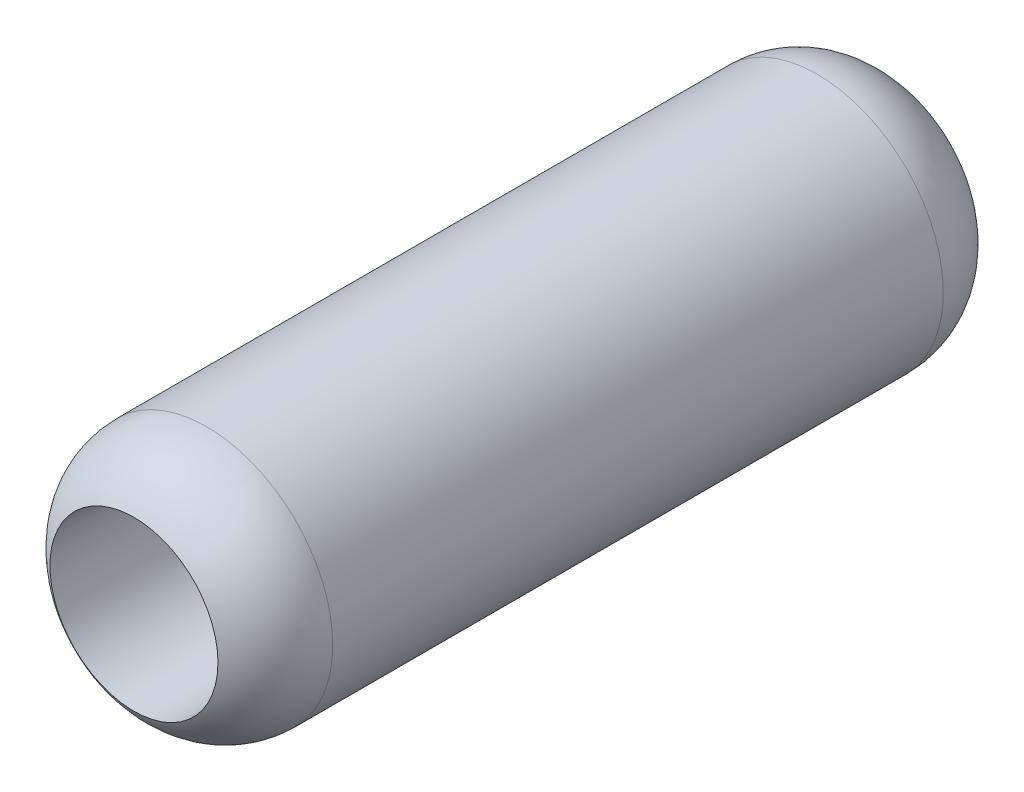
from build123d import *

# Parameters (mm, degrees)
SKETCH1_R           = 1.5
SKETCH1_R_2         = 1
BOSS_EXTRUDE1_DEPTH = 9
FILLET1_R           = 1


with BuildPart() as part:
    # Sketch1 → Boss-Extrude1 (new body)
    with BuildSketch(Plane.XY):
        with Locations((-0.00318309, -0.003564359)):
            Circle(SKETCH1_R)
        with Locations((-0.00318309, -0.003564359)):
            Circle(SKETCH1_R_2, mode=Mode.SUBTRACT)
    extrude(amount=BOSS_EXTRUDE1_DEPTH)

    # Fillet1
    # the kernel refuses this fillet: 1 mm, written as the material it takes off along each edge
    with BuildSketch(Plane(origin=(-0.00318309, -0.003564359, 0), x_dir=(1, 0, 0), z_dir=(0, -1, 0))) as fillet1_piece_1:
        with BuildLine():
            CenterArc((0.5, 0.866025404), FILLET1_R, 300, 60)
            Line((1, 0), (1.01, -0.017320508))
            ThreePointArc((1.01, -0.017320508), (1.25, -0.02), (1.5, -0.02))
            Line((1.5, -0.02), (1.52, 0))
            Line((1.52, 0), (1.52, 0.866025404))
            Line((1.52, 0.866025404), (1.5, 0.866025404))
        make_face()
    revolve(axis=Axis((-0.00318309, -0.003564359, 0), (0, 0, 1)), mode=Mode.SUBTRACT)
    with BuildSketch(Plane(origin=(-0.00318309, -0.003564359, 9), x_dir=(1, 0, 0), z_dir=(0, -1, 0))) as fillet1_piece_2:
        with BuildLine():
            CenterArc((0.5, -0.866025404), FILLET1_R, 0, 60)
            Line((1, 0), (1.01, 0.017320508))
            ThreePointArc((1.01, 0.017320508), (1.25, 0.02), (1.5, 0.02))
            Line((1.5, 0.02), (1.52, 0))
            Line((1.52, 0), (1.52, -0.866025404))
            Line((1.52, -0.866025404), (1.5, -0.866025404))
        make_face()
    revolve(axis=Axis((-0.00318309, -0.003564359, 9), (0, 0, 1)), mode=Mode.SUBTRACT)


solid = part.part
